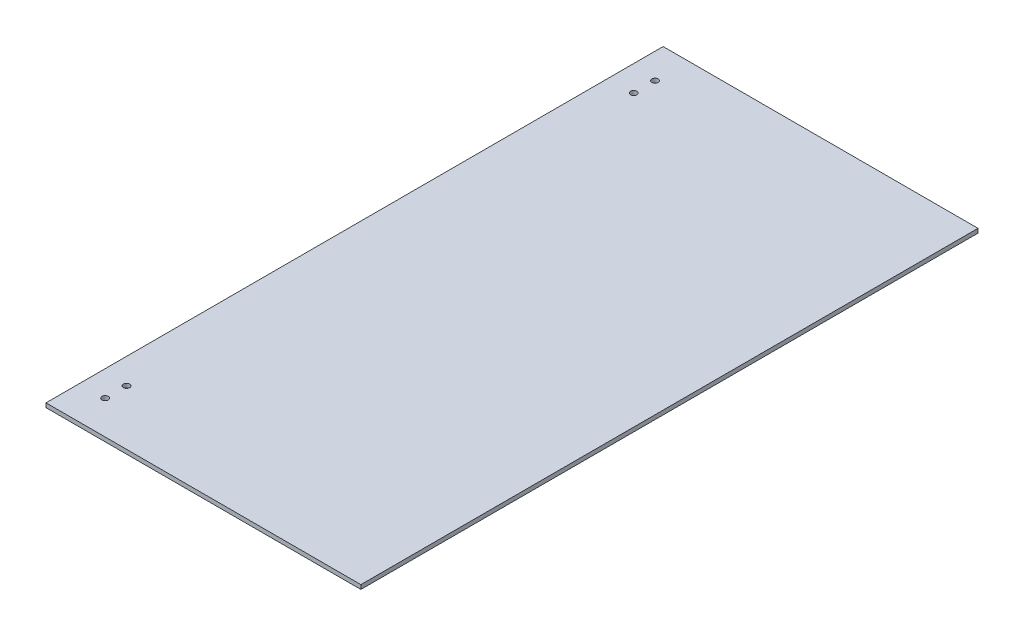
from build123d import *

# Parameters (mm, degrees)
SKETCH1_W           = 150
SKETCH1_H           = 294
BOSS_EXTRUDE1_DEPTH = 2
SKETCH2_R           = 1.5
CUT_EXTRUDE1_DEPTH  = 166.039389238


with BuildPart() as part:
    # Sketch1 → Boss-Extrude1 (new body)
    with BuildSketch(Plane(origin=(0, 0, 0), x_dir=(1, 0, 0), z_dir=(0, 1, 0))):
        Rectangle(SKETCH1_W, SKETCH1_H)
    extrude(amount=BOSS_EXTRUDE1_DEPTH)

    # Sketch2 → Cut-Extrude1 (cut, through all)
    with BuildSketch(Plane(origin=(0, 2, 0), x_dir=(1, 0, 0), z_dir=(0, 1, 0))):
        with Locations((-62.827286594, -130.972062041)):
            Circle(SKETCH2_R)
        with Locations((-62.827286594, -120.799557092)):
            Circle(SKETCH2_R)
        with Locations((-62.827286594, 120.799557092)):
            Circle(SKETCH2_R)
        with Locations((-62.827286594, 130.972062041)):
            Circle(SKETCH2_R)
    extrude(amount=-CUT_EXTRUDE1_DEPTH, mode=Mode.SUBTRACT)


solid = part.part
